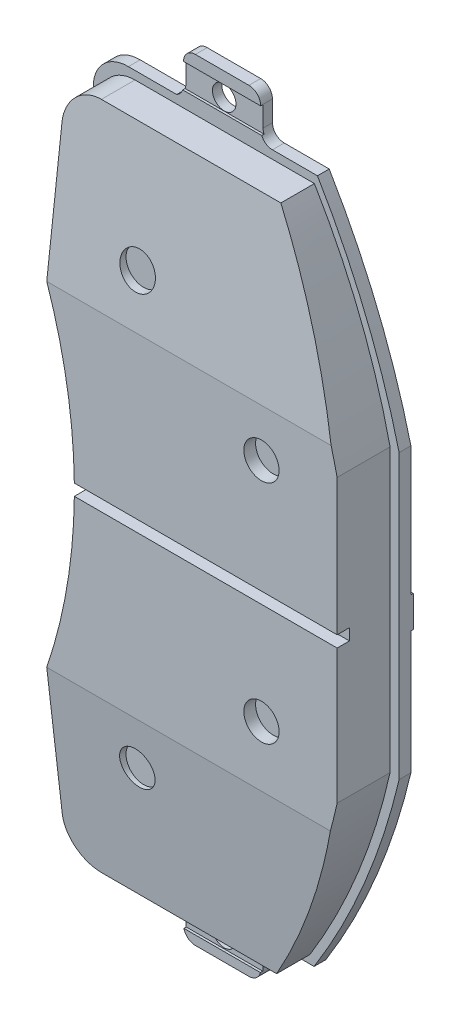
from build123d import *

# Parameters (mm, degrees)
SKETCH2_W               = 62.687945492
SKETCH2_H               = 144.612264151
EXTRUDE1_DEPTH          = 11.43
CUT_EXTRUDE2_DEPTH      = 158.024733797
CUT_EXTRUDE2_DEPTH_BACK = 158.024733797
FILLET1_R               = 7.62
CUT_EXTRUDE3_DEPTH      = 158.024733797
CUT_EXTRUDE4_DEPTH      = 11.43
SKETCH6_W               = 12.479780257
SKETCH6_H               = 2.472828988
CUT_EXTRUDE5_DEPTH      = 158.024733797
SKETCH7_R               = 3.81
CUT_EXTRUDE6_DEPTH      = 2.54
EXTRUDE2_DEPTH          = 2.54
SKETCH13_R              = 25
EXTRUDE4_DEPTH          = 0.635
SKETCH14_R              = 21.59
CUT_EXTRUDE7_DEPTH      = 2.54
SKETCH15_R              = 7.62
SKETCH15_R_2            = 5.08
EXTRUDE5_DEPTH          = 2.54
SKETCH16_R              = 2.54
CUT_EXTRUDE8_DEPTH      = 164.951198757
SKETCH17_W              = 37.108426787
SKETCH17_H              = 5.41310776
CUT_EXTRUDE9_DEPTH      = 0.508
SKETCH18_W              = 60.115740974
SKETCH18_H              = 6.745649024
EXTRUDE6_DEPTH          = 0.508


# Read off the part's stored shape, not the designer's step: Cut-Extrude4
with BuildPart() as part:
    # Sketch2 → Extrude1 (new body)
    with BuildSketch(Plane.XY):
        with Locations((107.157914046, -0.792085953)):
            Rectangle(SKETCH2_W, SKETCH2_H)
    extrude(amount=EXTRUDE1_DEPTH)

    # Sketch3 → Cut-Extrude2 (cut, two sides: drawn at the far end of the back side and taken through both)
    with BuildSketch(Plane.XY.offset(11.43).offset(-CUT_EXTRUDE2_DEPTH_BACK)):
        with BuildLine():
            Line((-8.245884216, 283.124432333), (75.8139413, 35.767808979))
            ThreePointArc((75.8139413, 35.767808979), (81.776003849, -0.305809979), (75.8139413, -36.379428938))
            Line((75.8139413, -36.379428938), (-8.245884216, -283.736052291))
            Line((-8.245884216, -283.736052291), (-530.745083766, -283.736052291))
            Line((-530.745083766, -283.736052291), (-530.745083766, 283.124432333))
            Line((-530.745083766, 283.124432333), (-8.245884216, 283.124432333))
        make_face()
    extrude(amount=CUT_EXTRUDE2_DEPTH + CUT_EXTRUDE2_DEPTH_BACK, mode=Mode.SUBTRACT)

    # Fillet1
    fillet1_edges = [part.edges().sort_by_distance(p)[0] for p in [
        (75.8139413, 71.514046122, 5.715),
        (138.501886792, 71.514046122, 5.715),
        (138.501886792, -73.098218029, 5.715),
        (75.8139413, -73.098218029, 5.715),
    ]]
    fillet(fillet1_edges, radius=FILLET1_R)

    # Sketch4 → Cut-Extrude3 (cut, through all)
    with BuildSketch(Plane(origin=(0, 0, 0), x_dir=(0, 0, -1), z_dir=(1, 0, 0))):
        Polygon((-6.9650624, -75.107104489), (-11.43, -36.379428938), (-27.808277113, -36.379428938), (-27.808277113, -75.107104489), align=None)
        Polygon((-6.9650624, 73.913379264), (-11.43, 35.767808979), (-27.808277113, 35.767808979), (-27.808277113, 73.913379264), align=None)
    extrude(amount=CUT_EXTRUDE3_DEPTH, mode=Mode.SUBTRACT)

    # Cut-Extrude4 outline → Cut-Extrude4 (cut)
    with BuildSketch(Plane.XY):
        with BuildLine():
            Line((130.881886792, 71.514046122), (122.168957501, 71.514046122))
            ThreePointArc((122.168957501, 71.514046122), (131.969322241, 51.63307619), (138.501886792, 30.452289734))
            Line((138.501886792, 30.452289734), (138.501886792, 63.894046122))
            ThreePointArc((138.501886792, 63.894046122), (136.270040464, 69.282199795), (130.881886792, 71.514046122))
        make_face()
        with BuildLine():
            Line((138.501886792, -65.478218029), (138.501886792, -30.452289734))
            ThreePointArc((138.501886792, -30.452289734), (131.624319899, -52.492129451), (121.210647413, -73.098218029))
            Line((121.210647413, -73.098218029), (130.881886792, -73.098218029))
            ThreePointArc((130.881886792, -73.098218029), (136.270040465, -70.866371702), (138.501886792, -65.478218029))
        make_face()
    extrude(amount=CUT_EXTRUDE4_DEPTH, mode=Mode.SUBTRACT)

    # Sketch6 → Cut-Extrude5 (cut, through all)
    with BuildSketch(Plane(origin=(0, 0, 0), x_dir=(0, 0, -1), z_dir=(1, 0, 0))):
        with Locations((-15.014254811, -0.20641593)):
            Rectangle(SKETCH6_W, SKETCH6_H)
    extrude(amount=CUT_EXTRUDE5_DEPTH, mode=Mode.SUBTRACT)

    # Sketch7 → Cut-Extrude6 (cut)
    with BuildSketch(Plane.XY.offset(11.43)):
        with Locations((122.168957501, 25.482679021)):
            Circle(SKETCH7_R)
        with Locations((122.168957501, -23.361435355)):
            Circle(SKETCH7_R)
        with Locations((94.197047539, -46.60449668)):
            Circle(SKETCH7_R)
        with Locations((94.197047539, 46.367748617)):
            Circle(SKETCH7_R)
    extrude(amount=-CUT_EXTRUDE6_DEPTH, mode=Mode.SUBTRACT)

    # Sketch11 → Extrude2 (add)
    with BuildSketch(Plane.XY):
        with BuildLine():
            Line((140.459634853, 30.367090459), (140.459634853, -30.772266502))
            ThreePointArc((140.459634853, -30.772266502), (133.081559649, -53.585706853), (122.100984967, -74.900397422))
            Line((122.100984967, -74.900397422), (113.111333503, -74.900397422))
            ThreePointArc((113.111333503, -74.900397422), (111.315282279, -75.644346198), (110.571333503, -77.440397422))
            Line((110.571333503, -77.440397422), (110.571333503, -81.248075827))
            ThreePointArc((110.571333503, -81.248075827), (109.827384728, -83.044127051), (108.031333503, -83.788075827))
            Line((108.031333503, -83.788075827), (96.467437878, -83.788075827))
            ThreePointArc((96.467437878, -83.788075827), (94.671386654, -83.044127051), (93.927437878, -81.248075827))
            Line((93.927437878, -81.248075827), (93.927437878, -77.440397422))
            ThreePointArc((93.927437878, -77.440397422), (93.183489102, -75.644346198), (91.387437878, -74.900397422))
            Line((91.387437878, -74.900397422), (84.20468933, -74.900397422))
            ThreePointArc((84.20468933, -74.900397422), (77.387287325, -72.495127974), (74.267438474, -65.97371445))
            Line((74.267438474, -65.97371445), (74.267438474, -35.993533901))
            ThreePointArc((74.267438474, -35.993533901), (80.424902626, -0.301125715), (74.435866454, 35.419929877))
            Line((74.435866454, 35.419929877), (74.435866454, 65.905394367))
            ThreePointArc((74.435866454, 65.905394367), (76.686596692, 71.178053101), (82.012839907, 73.298866609))
            Line((82.012839907, 73.298866609), (92.429737879, 73.298866609))
            ThreePointArc((92.429737879, 73.298866609), (93.525213934, 74.366945407), (93.927437878, 75.843114776))
            Line((93.927437878, 75.843114776), (93.927437878, 80.272142364))
            ThreePointArc((93.927437878, 80.272142364), (94.671386654, 82.068193588), (96.467437878, 82.812142364))
            Line((96.467437878, 82.812142364), (108.031333503, 82.812142364))
            ThreePointArc((108.031333503, 82.812142364), (109.827384728, 82.068193588), (110.571333503, 80.272142364))
            Line((110.571333503, 80.272142364), (110.571333503, 75.838866609))
            ThreePointArc((110.571333503, 75.838866609), (111.315282279, 74.042815385), (113.111333503, 73.298866609))
            Line((113.111333503, 73.298866609), (122.822960943, 73.298866609))
            ThreePointArc((122.822960943, 73.298866609), (133.212311059, 52.478361728), (140.459634853, 30.367090459))
        make_face()
    extrude(amount=-EXTRUDE2_DEPTH)

    # Sketch13 → Extrude4 (add)
    with BuildSketch(Plane(origin=(202.435743002, 23.123502913, -2.54), x_dir=(-1, 0, 0), z_dir=(0, 0, -1))):
        with Locations((92.140594683, 11.691074744)):
            Circle(SKETCH13_R)
        with Locations((92.140594683, -60.456163173)):
            Circle(SKETCH13_R)
    extrude(amount=EXTRUDE4_DEPTH)

    # Sketch14 → Cut-Extrude7 (cut)
    with BuildSketch(Plane(origin=(0, 0, -3.175), x_dir=(-1, 0, 0), z_dir=(0, 0, -1))):
        with Locations((-110.295148318, 34.814577657)):
            Circle(SKETCH14_R)
        with Locations((-110.295148318, -37.332660261)):
            Circle(SKETCH14_R)
    extrude(amount=-CUT_EXTRUDE7_DEPTH, mode=Mode.SUBTRACT)

    # Sketch15 → Extrude5 (add)
    # profile 1 of 2: a face of its own
    with BuildSketch(Plane(origin=(0, 0, -0.635), x_dir=(-1, 0, 0), z_dir=(0, 0, -1))):
        with Locations((-110.295148318, 34.814577657)):
            Circle(SKETCH15_R)
        with Locations((-110.295148318, 34.814577657)):
            Circle(SKETCH15_R_2, mode=Mode.SUBTRACT)
    # profile 2 of 2: a face of its own
    with BuildSketch(Plane(origin=(0, 0, -0.635), x_dir=(-1, 0, 0), z_dir=(0, 0, -1))):
        with Locations((-110.295148318, -37.332660261)):
            Circle(SKETCH15_R)
        with Locations((-110.295148318, -37.332660261)):
            Circle(SKETCH15_R_2, mode=Mode.SUBTRACT)
    extrude(amount=EXTRUDE5_DEPTH)

    # Sketch16 → Cut-Extrude8 (cut, through all)
    with BuildSketch(Plane.XY):
        with Locations((102.185519341, 77.398921819)):
            Circle(SKETCH16_R)
        with Locations((102.185519341, -79.070725904)):
            Circle(SKETCH16_R)
    extrude(amount=-CUT_EXTRUDE8_DEPTH, mode=Mode.SUBTRACT)

    # Sketch17 → Cut-Extrude9 (cut)
    with BuildSketch(Plane.XY):
        with Locations((105.706841443, -79.117825298)):
            Rectangle(SKETCH17_W, SKETCH17_H)
        with Locations((105.628622382, 77.519388414)):
            Rectangle(SKETCH17_W, SKETCH17_H)
    extrude(amount=-CUT_EXTRUDE9_DEPTH, mode=Mode.SUBTRACT)

    # Sketch18 → Extrude6 (add)
    with BuildSketch(Plane(origin=(0, 0, -2.54), x_dir=(-1, 0, 0), z_dir=(0, 0, -1))):
        with Locations((-110.401764366, -0.863643629)):
            Rectangle(SKETCH18_W, SKETCH18_H)
    extrude(amount=EXTRUDE6_DEPTH)


solid = part.part
